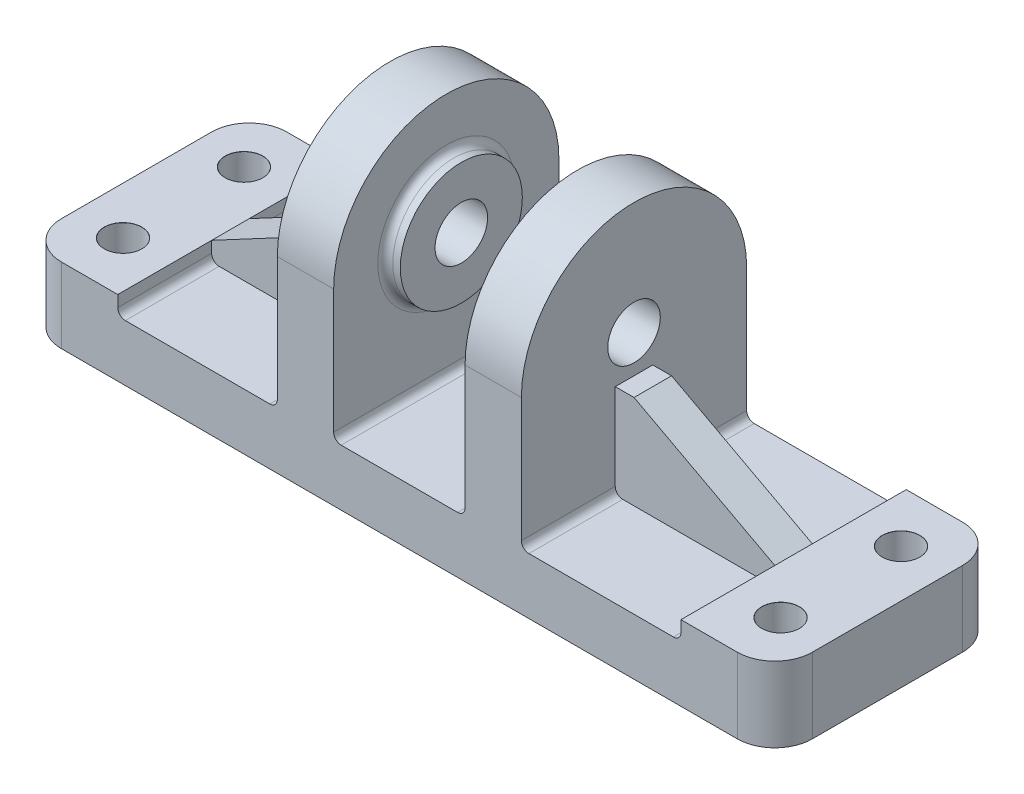
from build123d import *

# Parameters (mm, degrees)
SKETCH1_W                        = 200
SKETCH1_H                        = 60
BOSS_EXTRUDE1_DEPTH              = 20
SKETCH2_W                        = 150
SKETCH2_H                        = 60
CUT_EXTRUDE1_DEPTH               = 5
SKETCH5_R                        = 7
BOSS_EXTRUDE2_DEPTH              = 15
RIB1_START                       = -5
RIB1_DEPTH                       = 10
SKETCH7_R                        = 16.25
SKETCH7_R_2                      = 7
BOSS_EXTRUDE3_DEPTH              = 4
FILLET1_R                        = 10
FILLET2_R                        = 2
F_10_0MM_DOWEL_HOLE2_D           = 10
F_10_0MM_DOWEL_HOLE2_CSINK_D     = 10.05
F_10_0MM_DOWEL_HOLE2_CSINK_ANGLE = 90


# Read off the part's stored shape, not the designer's step: Rib1
with BuildPart() as part:
    # Sketch1 → Boss-Extrude1 (new body)
    with BuildSketch(Plane(origin=(0, 0, 0), x_dir=(1, 0, 0), z_dir=(0, 1, 0))):
        Rectangle(SKETCH1_W, SKETCH1_H)
    extrude(amount=BOSS_EXTRUDE1_DEPTH)

    # Sketch2 → Cut-Extrude1 (cut)
    with BuildSketch(Plane(origin=(0, 20, 0), x_dir=(1, 0, 0), z_dir=(0, 1, 0))):
        Rectangle(SKETCH2_W, SKETCH2_H)
    extrude(amount=-CUT_EXTRUDE1_DEPTH, mode=Mode.SUBTRACT)

    # Sketch5 → Boss-Extrude2 (add)
    with BuildSketch(Plane(origin=(-32.5, 0, 0), x_dir=(0, 0, -1), z_dir=(1, 0, 0))):
        with BuildLine():
            Line((-30, 15), (-30, 50))
            ThreePointArc((-30, 50), (0, 80), (30, 50))
            Line((30, 50), (30, 15))
            Line((30, 15), (-30, 15))
        make_face()
        with Locations((0, 50)):
            Circle(SKETCH5_R, mode=Mode.SUBTRACT)
    boss_extrude2 = extrude(amount=BOSS_EXTRUDE2_DEPTH)

    # Rib1 outline → Rib1 (add)
    with BuildSketch(Plane.XY.offset(RIB1_START)):
        Polygon((-37.5, 40), (-75, 20), (-75, 15), (-32.5, 15), (-32.5, 40), align=None)
    rib1 = extrude(amount=RIB1_DEPTH)

    # Sketch7 → Boss-Extrude3 (add)
    with BuildSketch(Plane(origin=(-17.5, 0, 0), x_dir=(0, 0, -1), z_dir=(1, 0, 0))):
        with Locations(Location((0, 50, 0), (0, 0, 180))):
            Circle(SKETCH7_R)
        with Locations((0, 50)):
            Circle(SKETCH7_R_2, mode=Mode.SUBTRACT)
    boss_extrude3 = extrude(amount=BOSS_EXTRUDE3_DEPTH)

    # Mirror1: Boss-Extrude2, Rib1, Boss-Extrude3 across plane
    add(boss_extrude2.mirror(Plane(origin=(0, 0, 0), x_dir=(0, 0, 1), z_dir=(1, 0, 0))))
    add(rib1.mirror(Plane(origin=(0, 0, 0), x_dir=(0, 0, 1), z_dir=(1, 0, 0))))
    add(boss_extrude3.mirror(Plane(origin=(0, 0, 0), x_dir=(0, 0, 1), z_dir=(1, 0, 0))))

    # Fillet1
    fillet1_edges = [part.edges().sort_by_distance(p)[0] for p in [
        (100, 10, 30),
        (-100, 10, 30),
        (-100, 10, -30),
        (100, 10, -30),
    ]]
    fillet(fillet1_edges, radius=FILLET1_R)

    # Fillet2
    fillet2_edges = [part.edges().sort_by_distance(p)[0] for p in [
        (32.5, 15, -17.5),
        (75, 15, -17.5),
        (17.5, 50, -16.25),
        (75, 15, 17.5),
        (-75, 15, -17.5),
        (-17.5, 15, 0),
        (-32.5, 15, 17.5),
        (-32.5, 15, -17.5),
        (-75, 15, 17.5),
        (-17.5, 50, -16.25),
        (17.5, 15, 0),
        (32.5, 15, 17.5),
    ]]
    fillet(fillet2_edges, radius=FILLET2_R)

    # Ø10.0mm Dowel Hole2 (through all)
    with Locations(Plane(origin=(0, 20, 0), x_dir=(1, 0, 0), z_dir=(0, 1, 0))):
        with Locations((-87.631640785, 16.25), (-87.345692882, -16.25), (87.368359215, 16.25), (87.781361724, -16.247375724)):
            CounterSinkHole(F_10_0MM_DOWEL_HOLE2_D / 2, F_10_0MM_DOWEL_HOLE2_CSINK_D / 2, counter_sink_angle=F_10_0MM_DOWEL_HOLE2_CSINK_ANGLE)


solid = part.part
